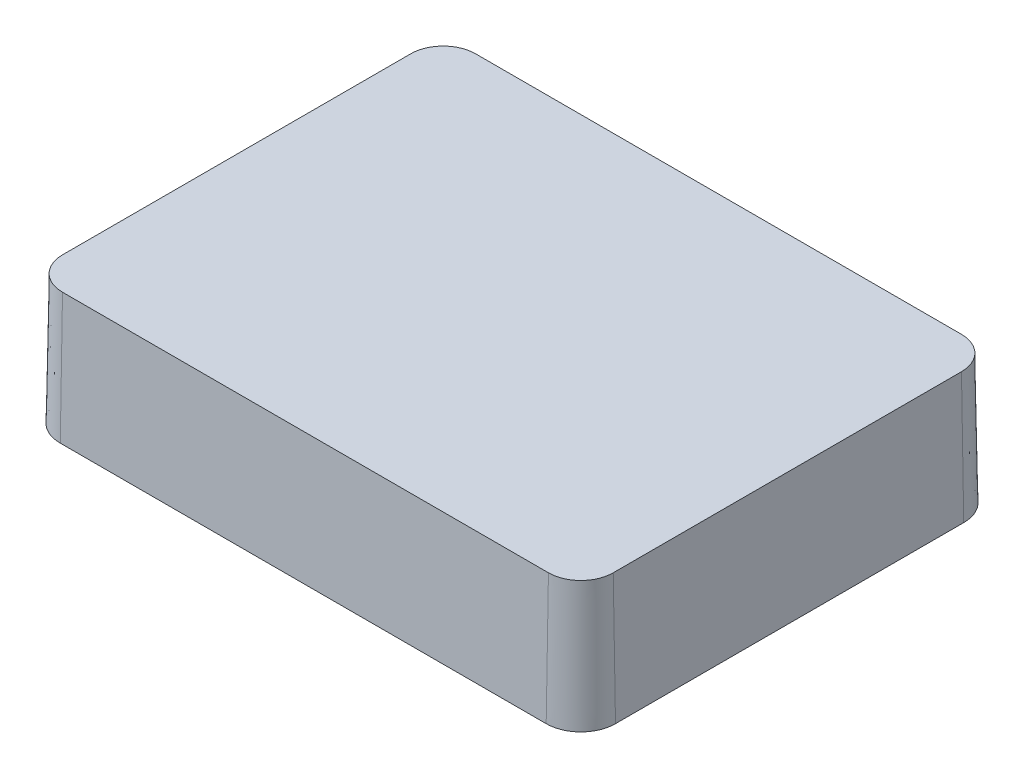
from build123d import *

# Parameters (mm, degrees)
BOSS_EXTRUDE1_DEPTH = 4
BOSS_EXTRUDE1_DRAFT = 1
SHELL1_T            = -0.5
SKETCH2_R           = 2
BOSS_EXTRUDE2_DEPTH = 5.5
BOSS_EXTRUDE2_TAPER = 1.5
RIB1_START          = -0.25
RIB1_DEPTH          = 0.5
CIRPATTERN1_COUNT   = 4


# Read off the part's stored shape, not the designer's step: Rib1
with BuildPart() as part:
    # Sketch1 → Boss-Extrude1 (with draft: the straight prism first)
    with BuildSketch(Plane(origin=(0, 0, 0), x_dir=(1, 0, 0), z_dir=(0, 1, 0))):
        with BuildLine():
            Line((-7.5, -6.375), (7.5, -6.375))
            ThreePointArc((7.5, -6.375), (8.207106781, -6.082106781), (8.5, -5.375))
            Line((8.5, -5.375), (8.5, 5.375))
            ThreePointArc((8.5, 5.375), (8.207106781, 6.082106781), (7.5, 6.375))
            Line((7.5, 6.375), (-7.5, 6.375))
            ThreePointArc((-7.5, 6.375), (-8.207106781, 6.082106781), (-8.5, 5.375))
            Line((-8.5, 5.375), (-8.5, -5.375))
            ThreePointArc((-8.5, -5.375), (-8.207106781, -6.082106781), (-7.5, -6.375))
        make_face()
    extrude(amount=-BOSS_EXTRUDE1_DEPTH)
    # Boss-Extrude1: the draft: its side faces are tilted about the plane it starts from
    boss_extrude1_sides = [part.faces().sort_by_distance(p)[0] for p in [
        (0, -2, 6.375),
        (8.207106781, -2, 6.082106781),
        (8.5, -2, 0),
        (8.207106781, -2, -6.082106781),
        (0, -2, -6.375),
        (-8.207106781, -2, -6.082106781),
        (-8.5, -2, 0),
        (-8.207106781, -2, 6.082106781),
    ]]
    draft(boss_extrude1_sides, Plane(origin=(0, 0, 0), x_dir=(1, 0, 0), z_dir=(0, 1, 0)), BOSS_EXTRUDE1_DRAFT)

    # Shell1
    shell1_openings = [part.faces().sort_by_distance(p)[0] for p in [
        (0, -4, 0),
    ]]
    offset(amount=SHELL1_T, openings=shell1_openings, kind=Kind.INTERSECTION)

    # Sketch2 → Boss-Extrude2 (add)
    with BuildSketch(Plane.XZ.offset(0.5)):
        Circle(SKETCH2_R)
    extrude(amount=BOSS_EXTRUDE2_DEPTH, taper=BOSS_EXTRUDE2_TAPER)

    # Rib1 outline → Rib1 (add)
    with BuildSketch(Plane.XY.offset(RIB1_START)):
        Polygon((-2.396376072, -4.46378352), (-1, -4.46378352), (-1, 0), (-2.893975097, 0), (-2.838237736, -0.5), align=None)
    rib1 = extrude(amount=RIB1_DEPTH)

    # CirPattern1: Rib1 ×4 about axis
    cirpattern1_axis = Axis((0, 0, 0), (0, 1, 0))
    for i in range(1, CIRPATTERN1_COUNT):
        add(rib1.rotate(cirpattern1_axis, i * 360 / CIRPATTERN1_COUNT))


solid = part.part
